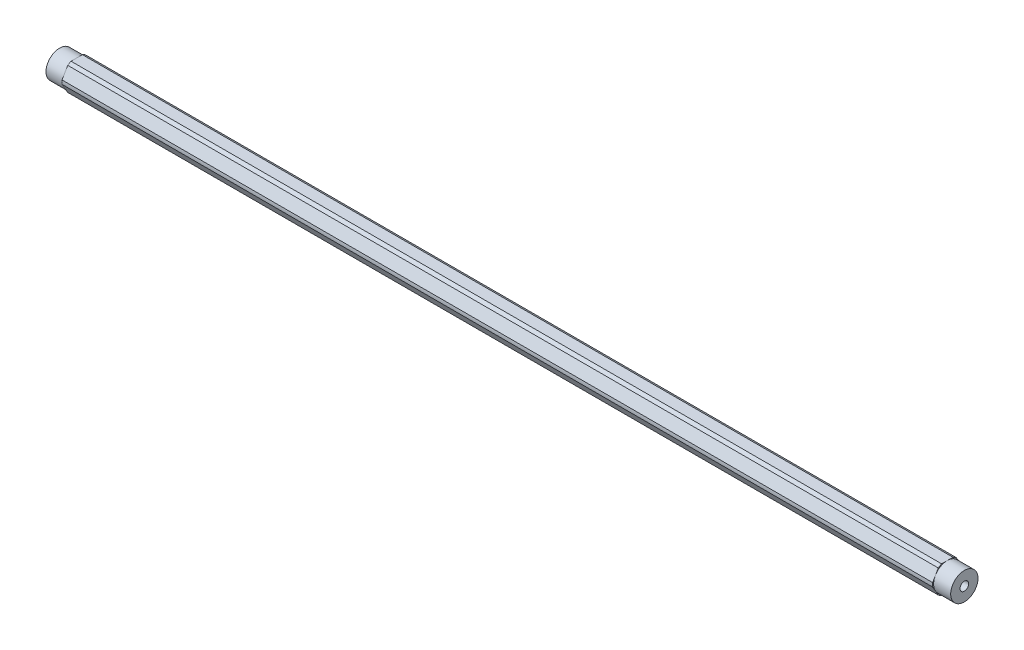
from build123d import *

# Parameters (mm, degrees)
SKETCH1_R               = 2.0193
BOSS_EXTRUDE1_DEPTH     = 210.34375
SKETCH2_R               = 8.89
SKETCH2_R_2             = 6.35
CUT_EXTRUDE_THIN1_DEPTH = 7.9375


with BuildPart() as part:
    # Sketch1 → Boss-Extrude1 (new, symmetric)
    with BuildSketch(Plane(origin=(0, 0, 0), x_dir=(0, 0, -1), z_dir=(1, 0, 0))):
        with BuildLine():
            ThreePointArc((4.181770846, 5.456960429), (3.437499983, 5.953924622), (2.634980936, 6.35))
            Line((2.634980936, 6.35), (-2.634980936, 6.35))
            ThreePointArc((-2.634980936, 6.35), (-3.437499983, 5.953924622), (-4.181770846, 5.456960429))
            Line((-4.181770846, 5.456960429), (-6.816751782, 0.893039571))
            ThreePointArc((-6.816751782, 0.893039571), (-6.874999966, 0), (-6.816751782, -0.893039571))
            Line((-6.816751782, -0.893039571), (-4.181770846, -5.456960429))
            ThreePointArc((-4.181770846, -5.456960429), (-3.437499983, -5.953924622), (-2.634980936, -6.35))
            Line((-2.634980936, -6.35), (2.634980936, -6.35))
            ThreePointArc((2.634980936, -6.35), (3.437499983, -5.953924622), (4.181770846, -5.456960429))
            Line((4.181770846, -5.456960429), (6.816751782, -0.893039571))
            ThreePointArc((6.816751782, -0.893039571), (6.860422465, -0.447468582), (6.874999966, 0))
            ThreePointArc((6.874999966, 0), (6.860422465, 0.447468582), (6.816751782, 0.893039571))
            Line((6.816751782, 0.893039571), (4.181770846, 5.456960429))
        make_face()
        Circle(SKETCH1_R, mode=Mode.SUBTRACT)
    extrude(amount=BOSS_EXTRUDE1_DEPTH, both=True)

    # Sketch2 → Cut-Extrude-Thin1 (cut)
    with BuildSketch(Plane(origin=(210.34375, 0, 0), x_dir=(0, 0, -1), z_dir=(1, 0, 0))):
        Circle(SKETCH2_R)
        Circle(SKETCH2_R_2, mode=Mode.SUBTRACT)
    cut_extrude_thin1 = extrude(amount=-CUT_EXTRUDE_THIN1_DEPTH, mode=Mode.SUBTRACT)

    # Mirror1: Cut-Extrude-Thin1 across plane
    add(cut_extrude_thin1.mirror(Plane(origin=(0, 0, 0), x_dir=(0, 0, 1), z_dir=(1, 0, 0))), mode=Mode.SUBTRACT)


solid = part.part
